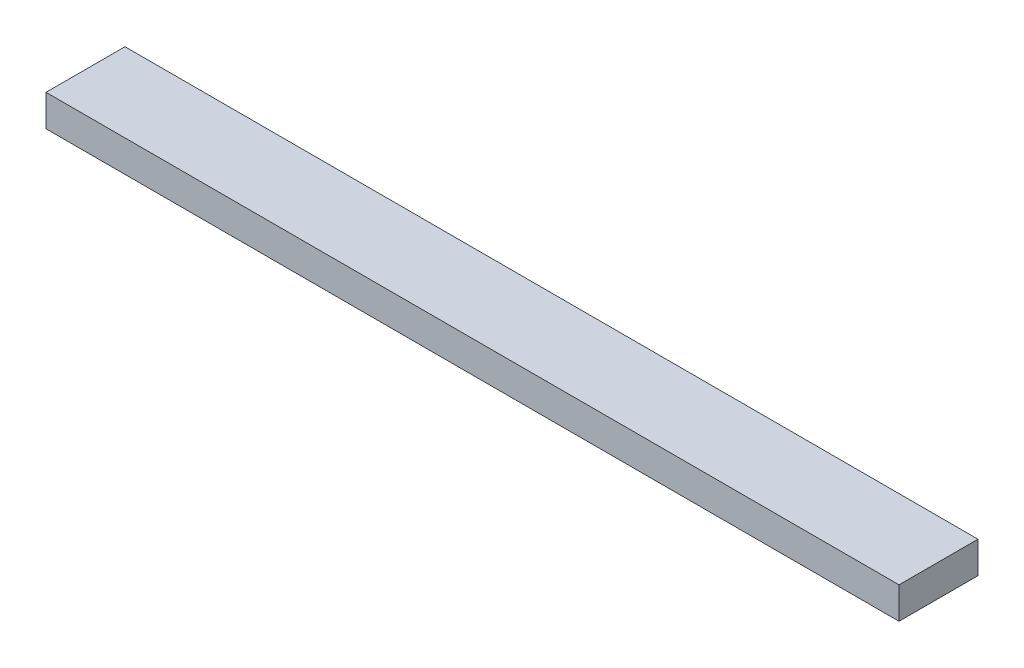
from build123d import *

# Parameters (mm, degrees)
SKETCH_1_W      = 540
SKETCH_1_H      = 50
EXTRUDE_1_DEPTH = 20


with BuildPart() as part:
    # Эскиз1 → Бобышка-Вытянуть1 (new body)
    with BuildSketch(Plane(origin=(0, 0, 0), x_dir=(1, 0, 0), z_dir=(0, 1, 0))):
        Rectangle(SKETCH_1_W, SKETCH_1_H)
    extrude(amount=EXTRUDE_1_DEPTH)


solid = part.part
